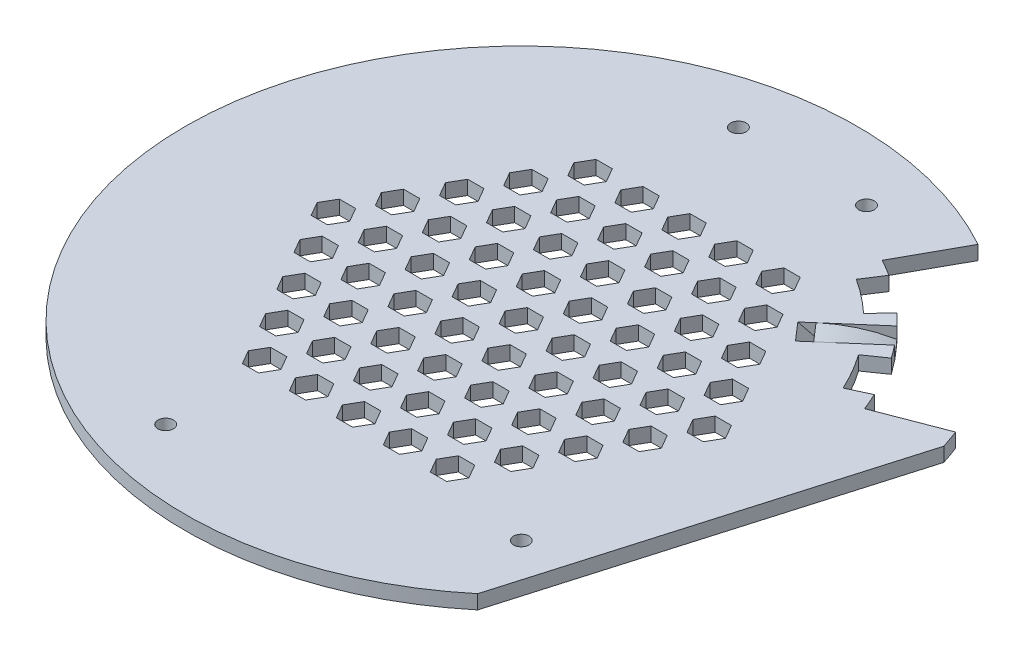
from build123d import *

# Parameters (mm, degrees)
BOSS_EXTRUDE1_DEPTH     = 3
CUT_EXTRUDE1_DEPTH      = 102.224374782
CUT_EXTRUDE2_DEPTH      = 10
FILL_PATTERN1_DEPTH     = 3
CUT_EXTRUDE3_DEPTH      = 2.5
CUT_EXTRUDE3_DEPTH_BACK = 2.5
SKETCH7_R               = 1.65
CUT_EXTRUDE4_DEPTH      = 102.224374785


# Read off the part's stored shape, not the designer's step: Fill Pattern1
with BuildPart() as part:
    # Sketch1 → Boss-Extrude1 (new body)
    with BuildSketch(Plane(origin=(0, 0, 0), x_dir=(1, 0, 0), z_dir=(0, 1, 0))):
        with BuildLine():
            Line((45.736375855, -55.017005995), (68.149505263, 21.779163377))
            ThreePointArc((68.149505263, 21.779163377), (67.498860282, 23.71899841), (66.793011614, 25.63943495))
            Line((66.793011614, 25.63943495), (52.789305216, 20.263915707))
            ThreePointArc((52.789305216, 20.263915707), (42.645904251, 37.130363258), (27.335841873, 49.498371429))
            Line((27.335841873, 49.498371429), (34.587369472, 62.629073903))
            ThreePointArc((34.587369472, 62.629073903), (-71.225880442, -6.749887428), (45.736375855, -55.017005995))
        make_face()
    extrude(amount=BOSS_EXTRUDE1_DEPTH)

    # Sketch2 → Cut-Extrude1 (cut, through all)
    with BuildSketch(Plane(origin=(0, 0, 0), x_dir=(1, 0, 0), z_dir=(0, 1, 0))):
        with BuildLine():
            Line((42.227287883, 29.567865294), (46.318952344, 32.432879593))
            ThreePointArc((46.318952344, 32.432879593), (48.969406457, 28.2725), (51.247173818, 23.89694961))
            Line((51.247173818, 23.89694961), (46.720166422, 21.785971393))
            ThreePointArc((46.720166422, 21.785971393), (44.643609565, 25.775), (42.227287883, 29.567865294))
        make_face()
        with BuildLine():
            Line((30.796614235, 47.422627264), (28.076142255, 43.233467778))
            ThreePointArc((28.076142255, 43.233467778), (31.737349053, 40.621954348), (35.157015461, 37.701283318))
            Line((35.157015461, 37.701283318), (38.56359727, 41.354395058))
            ThreePointArc((38.56359727, 41.354395058), (34.812578122, 44.558068063), (30.796614235, 47.422627264))
        make_face()
    extrude(amount=CUT_EXTRUDE1_DEPTH, mode=Mode.SUBTRACT)

    # Sketch3 → Cut-Extrude2 (cut)
    with BuildSketch(Plane(origin=(0, 0, 0), x_dir=(1, 0, 0), z_dir=(0, 1, 0))):
        Polygon((3.464101615, 0), (1.732050808, 3), (-1.732050808, 3), (-3.464101615, 0), (-1.732050808, -3), (1.732050808, -3), align=None)
    extrude(amount=CUT_EXTRUDE2_DEPTH, mode=Mode.SUBTRACT)

    # Fill Pattern1 outline → Fill Pattern1 (cut)
    with BuildSketch(Plane(origin=(0, 0, 0), x_dir=(1, 0, 0), z_dir=(0, 1, 0))):
        Polygon((-18.267949192, -37.641016151), (-16.535898385, -34.641016151), (-18.267949192, -31.641016151), (-21.732050808, -31.641016151), (-23.464101615, -34.641016151), (-21.732050808, -37.641016151), align=None)
        Polygon((11.732050808, 14.320508076), (13.464101615, 17.320508076), (11.732050808, 20.320508076), (8.267949192, 20.320508076), (6.535898385, 17.320508076), (8.267949192, 14.320508076), align=None)
        Polygon((16.732050808, 22.980762114), (18.464101615, 25.980762114), (16.732050808, 28.980762114), (13.267949192, 28.980762114), (11.535898385, 25.980762114), (13.267949192, 22.980762114), align=None)
        Polygon((21.732050808, 31.641016151), (23.464101615, 34.641016151), (21.732050808, 37.641016151), (18.267949192, 37.641016151), (16.535898385, 34.641016151), (18.267949192, 31.641016151), align=None)
        Polygon((6.732050808, 5.660254038), (8.464101615, 8.660254038), (6.732050808, 11.660254038), (3.267949192, 11.660254038), (1.535898385, 8.660254038), (3.267949192, 5.660254038), align=None)
        Polygon((-3.267949192, -11.660254038), (-1.535898385, -8.660254038), (-3.267949192, -5.660254038), (-6.732050808, -5.660254038), (-8.464101615, -8.660254038), (-6.732050808, -11.660254038), align=None)
        Polygon((-8.267949192, -20.320508076), (-6.535898385, -17.320508076), (-8.267949192, -14.320508076), (-11.732050808, -14.320508076), (-13.464101615, -17.320508076), (-11.732050808, -20.320508076), align=None)
        Polygon((-13.267949192, -28.980762114), (-11.535898385, -25.980762114), (-13.267949192, -22.980762114), (-16.732050808, -22.980762114), (-18.464101615, -25.980762114), (-16.732050808, -28.980762114), align=None)
        Polygon((-16.535898385, 34.641016151), (-18.267949192, 37.641016151), (-21.732050808, 37.641016151), (-23.464101615, 34.641016151), (-21.732050808, 31.641016151), (-18.267949192, 31.641016151), align=None)
        Polygon((13.464101615, -17.320508076), (11.732050808, -14.320508076), (8.267949192, -14.320508076), (6.535898385, -17.320508076), (8.267949192, -20.320508076), (11.732050808, -20.320508076), align=None)
        Polygon((8.464101615, -8.660254038), (6.732050808, -5.660254038), (3.267949192, -5.660254038), (1.535898385, -8.660254038), (3.267949192, -11.660254038), (6.732050808, -11.660254038), align=None)
        Polygon((23.464101615, -34.641016151), (21.732050808, -31.641016151), (18.267949192, -31.641016151), (16.535898385, -34.641016151), (18.267949192, -37.641016151), (21.732050808, -37.641016151), align=None)
        Polygon((18.464101615, -25.980762114), (16.732050808, -22.980762114), (13.267949192, -22.980762114), (11.535898385, -25.980762114), (13.267949192, -28.980762114), (16.732050808, -28.980762114), align=None)
        Polygon((-6.535898385, 17.320508076), (-8.267949192, 20.320508076), (-11.732050808, 20.320508076), (-13.464101615, 17.320508076), (-11.732050808, 14.320508076), (-8.267949192, 14.320508076), align=None)
        Polygon((-11.535898385, 25.980762114), (-13.267949192, 28.980762114), (-16.732050808, 28.980762114), (-18.464101615, 25.980762114), (-16.732050808, 22.980762114), (-13.267949192, 22.980762114), align=None)
        Polygon((-1.535898385, 8.660254038), (-3.267949192, 11.660254038), (-6.732050808, 11.660254038), (-8.464101615, 8.660254038), (-6.732050808, 5.660254038), (-3.267949192, 5.660254038), align=None)
        Polygon((21.732050808, 3), (18.267949192, 3), (16.535898385, 0), (18.267949192, -3), (21.732050808, -3), (23.464101615, 0), align=None)
        Polygon((11.732050808, 3), (8.267949192, 3), (6.535898385, 0), (8.267949192, -3), (11.732050808, -3), (13.464101615, 0), align=None)
        Polygon((31.732050808, 3), (28.267949192, 3), (26.535898385, 0), (28.267949192, -3), (31.732050808, -3), (33.464101615, 0), align=None)
        Polygon((41.732050808, 3), (38.267949192, 3), (36.535898385, 0), (38.267949192, -3), (41.732050808, -3), (43.464101615, 0), align=None)
        Polygon((-28.267949192, 3), (-31.732050808, 3), (-33.464101615, 0), (-31.732050808, -3), (-28.267949192, -3), (-26.535898385, 0), align=None)
        Polygon((-18.267949192, 3), (-21.732050808, 3), (-23.464101615, 0), (-21.732050808, -3), (-18.267949192, -3), (-16.535898385, 0), align=None)
        Polygon((-38.267949192, 3), (-41.732050808, 3), (-43.464101615, 0), (-41.732050808, -3), (-38.267949192, -3), (-36.535898385, 0), align=None)
        Polygon((-8.267949192, 3), (-11.732050808, 3), (-13.464101615, 0), (-11.732050808, -3), (-8.267949192, -3), (-6.535898385, 0), align=None)
        Polygon((-23.267949192, 22.980762114), (-21.535898385, 25.980762114), (-23.267949192, 28.980762114), (-26.732050808, 28.980762114), (-28.464101615, 25.980762114), (-26.732050808, 22.980762114), align=None)
        Polygon((-28.267949192, 14.320508076), (-26.535898385, 17.320508076), (-28.267949192, 20.320508076), (-31.732050808, 20.320508076), (-33.464101615, 17.320508076), (-31.732050808, 14.320508076), align=None)
        Polygon((-33.267949192, 5.660254038), (-31.535898385, 8.660254038), (-33.267949192, 11.660254038), (-36.732050808, 11.660254038), (-38.464101615, 8.660254038), (-36.732050808, 5.660254038), align=None)
        Polygon((1.732050808, 37.641016151), (-1.732050808, 37.641016151), (-3.464101615, 34.641016151), (-1.732050808, 31.641016151), (1.732050808, 31.641016151), (3.464101615, 34.641016151), align=None)
        Polygon((-8.267949192, 37.641016151), (-11.732050808, 37.641016151), (-13.464101615, 34.641016151), (-11.732050808, 31.641016151), (-8.267949192, 31.641016151), (-6.535898385, 34.641016151), align=None)
        Polygon((11.732050808, 37.641016151), (8.267949192, 37.641016151), (6.535898385, 34.641016151), (8.267949192, 31.641016151), (11.732050808, 31.641016151), (13.464101615, 34.641016151), align=None)
        Polygon((26.732050808, 5.660254038), (28.464101615, 8.660254038), (26.732050808, 11.660254038), (23.267949192, 11.660254038), (21.535898385, 8.660254038), (23.267949192, 5.660254038), align=None)
        Polygon((31.732050808, 14.320508076), (33.464101615, 17.320508076), (31.732050808, 20.320508076), (28.267949192, 20.320508076), (26.535898385, 17.320508076), (28.267949192, 14.320508076), align=None)
        Polygon((16.732050808, -11.660254038), (18.464101615, -8.660254038), (16.732050808, -5.660254038), (13.267949192, -5.660254038), (11.535898385, -8.660254038), (13.267949192, -11.660254038), align=None)
        Polygon((6.732050808, -28.980762114), (8.464101615, -25.980762114), (6.732050808, -22.980762114), (3.267949192, -22.980762114), (1.535898385, -25.980762114), (3.267949192, -28.980762114), align=None)
        Polygon((1.732050808, -37.641016151), (3.464101615, -34.641016151), (1.732050808, -31.641016151), (-1.732050808, -31.641016151), (-3.464101615, -34.641016151), (-1.732050808, -37.641016151), align=None)
        Polygon((18.464101615, 8.660254038), (16.732050808, 11.660254038), (13.267949192, 11.660254038), (11.535898385, 8.660254038), (13.267949192, 5.660254038), (16.732050808, 5.660254038), align=None)
        Polygon((33.464101615, -17.320508076), (31.732050808, -14.320508076), (28.267949192, -14.320508076), (26.535898385, -17.320508076), (28.267949192, -20.320508076), (31.732050808, -20.320508076), align=None)
        Polygon((28.464101615, -8.660254038), (26.732050808, -5.660254038), (23.267949192, -5.660254038), (21.535898385, -8.660254038), (23.267949192, -11.660254038), (26.732050808, -11.660254038), align=None)
        Polygon((8.464101615, 25.980762114), (6.732050808, 28.980762114), (3.267949192, 28.980762114), (1.535898385, 25.980762114), (3.267949192, 22.980762114), (6.732050808, 22.980762114), align=None)
        Polygon((23.464101615, 17.320508076), (21.732050808, 20.320508076), (18.267949192, 20.320508076), (16.535898385, 17.320508076), (18.267949192, 14.320508076), (21.732050808, 14.320508076), align=None)
        Polygon((38.464101615, -8.660254038), (36.732050808, -5.660254038), (33.267949192, -5.660254038), (31.535898385, -8.660254038), (33.267949192, -11.660254038), (36.732050808, -11.660254038), align=None)
        Polygon((36.732050808, 11.660254038), (33.267949192, 11.660254038), (31.535898385, 8.660254038), (33.267949192, 5.660254038), (36.732050808, 5.660254038), (38.464101615, 8.660254038), align=None)
        Polygon((-13.267949192, 11.660254038), (-16.732050808, 11.660254038), (-18.464101615, 8.660254038), (-16.732050808, 5.660254038), (-13.267949192, 5.660254038), (-11.535898385, 8.660254038), align=None)
        Polygon((-23.267949192, 11.660254038), (-26.732050808, 11.660254038), (-28.464101615, 8.660254038), (-26.732050808, 5.660254038), (-23.267949192, 5.660254038), (-21.535898385, 8.660254038), align=None)
        Polygon((28.464101615, 25.980762114), (26.732050808, 28.980762114), (23.267949192, 28.980762114), (21.535898385, 25.980762114), (23.267949192, 22.980762114), (26.732050808, 22.980762114), align=None)
        Polygon((-18.267949192, 20.320508076), (-21.732050808, 20.320508076), (-23.464101615, 17.320508076), (-21.732050808, 14.320508076), (-18.267949192, 14.320508076), (-16.535898385, 17.320508076), align=None)
        Polygon((1.732050808, 20.320508076), (-1.732050808, 20.320508076), (-3.464101615, 17.320508076), (-1.732050808, 14.320508076), (1.732050808, 14.320508076), (3.464101615, 17.320508076), align=None)
        Polygon((-8.267949192, -37.641016151), (-6.535898385, -34.641016151), (-8.267949192, -31.641016151), (-11.732050808, -31.641016151), (-13.464101615, -34.641016151), (-11.732050808, -37.641016151), align=None)
        Polygon((1.732050808, -20.320508076), (3.464101615, -17.320508076), (1.732050808, -14.320508076), (-1.732050808, -14.320508076), (-3.464101615, -17.320508076), (-1.732050808, -20.320508076), align=None)
        Polygon((-3.267949192, -28.980762114), (-1.535898385, -25.980762114), (-3.267949192, -22.980762114), (-6.732050808, -22.980762114), (-8.464101615, -25.980762114), (-6.732050808, -28.980762114), align=None)
        Polygon((-21.535898385, -8.660254038), (-23.267949192, -5.660254038), (-26.732050808, -5.660254038), (-28.464101615, -8.660254038), (-26.732050808, -11.660254038), (-23.267949192, -11.660254038), align=None)
        Polygon((-16.535898385, -17.320508076), (-18.267949192, -14.320508076), (-21.732050808, -14.320508076), (-23.464101615, -17.320508076), (-21.732050808, -20.320508076), (-18.267949192, -20.320508076), align=None)
        Polygon((11.732050808, -31.641016151), (8.267949192, -31.641016151), (6.535898385, -34.641016151), (8.267949192, -37.641016151), (11.732050808, -37.641016151), (13.464101615, -34.641016151), align=None)
        Polygon((28.464101615, -25.980762114), (26.732050808, -22.980762114), (23.267949192, -22.980762114), (21.535898385, -25.980762114), (23.267949192, -28.980762114), (26.732050808, -28.980762114), align=None)
        Polygon((23.464101615, -17.320508076), (21.732050808, -14.320508076), (18.267949192, -14.320508076), (16.535898385, -17.320508076), (18.267949192, -20.320508076), (21.732050808, -20.320508076), align=None)
        Polygon((-1.535898385, 25.980762114), (-3.267949192, 28.980762114), (-6.732050808, 28.980762114), (-8.464101615, 25.980762114), (-6.732050808, 22.980762114), (-3.267949192, 22.980762114), align=None)
        Polygon((-33.267949192, -5.660254038), (-36.732050808, -5.660254038), (-38.464101615, -8.660254038), (-36.732050808, -11.660254038), (-33.267949192, -11.660254038), (-31.535898385, -8.660254038), align=None)
        Polygon((-13.267949192, -5.660254038), (-16.732050808, -5.660254038), (-18.464101615, -8.660254038), (-16.732050808, -11.660254038), (-13.267949192, -11.660254038), (-11.535898385, -8.660254038), align=None)
        Polygon((-28.267949192, -14.320508076), (-31.732050808, -14.320508076), (-33.464101615, -17.320508076), (-31.732050808, -20.320508076), (-28.267949192, -20.320508076), (-26.535898385, -17.320508076), align=None)
        Polygon((-23.267949192, -22.980762114), (-26.732050808, -22.980762114), (-28.464101615, -25.980762114), (-26.732050808, -28.980762114), (-23.267949192, -28.980762114), (-21.535898385, -25.980762114), align=None)
    extrude(amount=FILL_PATTERN1_DEPTH, mode=Mode.SUBTRACT)

    # Sketch6 → Cut-Extrude3 (cut, two sides: drawn at the far end of the back side and taken through both)
    with BuildSketch(Plane(origin=(0, 0, 0), x_dir=(0.754709580222778, 0, -0.6560590289905005), z_dir=(0.6560590289905005, 0, 0.754709580222778)).offset(-CUT_EXTRUDE3_DEPTH_BACK)):
        with BuildLine():
            ThreePointArc((44.295, 3), (50.546249875, 2.368624388), (56.545, 0.5))
            Line((56.545, 0.5), (56.545, 3))
            Line((56.545, 3), (44.295, 3))
        make_face()
        Polygon((44.295, 0.5), (44.295, 3), (41.545, 3), (44.045, 0.5), align=None)
    extrude(amount=CUT_EXTRUDE3_DEPTH + CUT_EXTRUDE3_DEPTH_BACK, mode=Mode.SUBTRACT)

    # Sketch7 → Cut-Extrude4 (cut, through all)
    with BuildSketch(Plane(origin=(0, 0, 0), x_dir=(1, 0, 0), z_dir=(0, 1, 0))):
        with Locations(Location((-12.474701449, 58.688856044, 0), (0, 0, 90))):
            Circle(SKETCH7_R)
        with Locations(Location((15.529142706, 57.955549577, 0), (0, 0, 90))):
            Circle(SKETCH7_R)
        with Locations(Location((-18.674701449, -57.021143956, 0), (0, 0, 90))):
            Circle(SKETCH7_R)
        with Locations(Location((40.575649573, -40.575649573, 0), (0, 0, 90))):
            Circle(SKETCH7_R)
    extrude(amount=CUT_EXTRUDE4_DEPTH, mode=Mode.SUBTRACT)


solid = part.part
